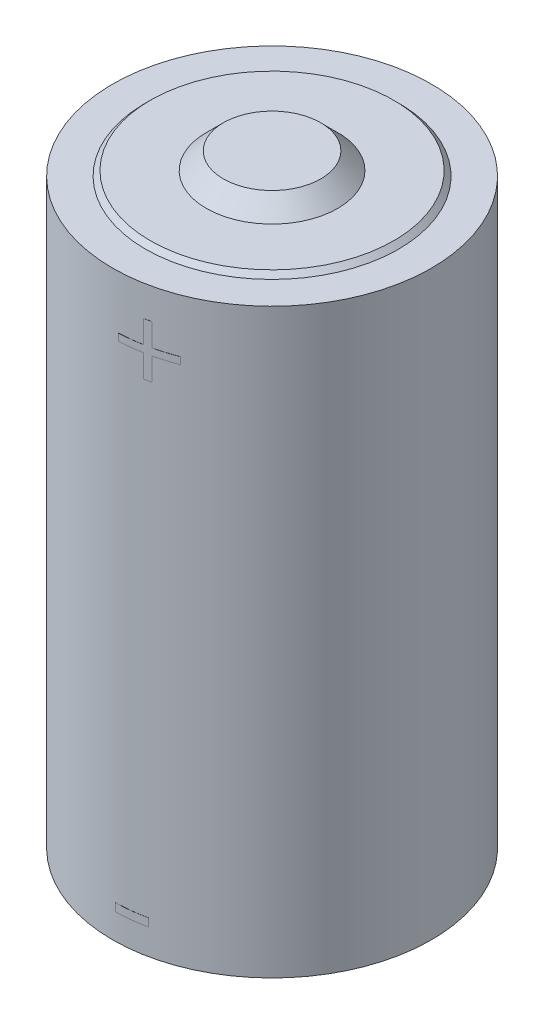
from build123d import *

# Parameters (mm, degrees)
SKETCH1_R           = 13.1
BOSS_EXTRUDE1_DEPTH = 47.8
SKETCH2_R           = 10
BOSS_EXTRUDE2_DEPTH = 0.4
SKETCH3_R           = 4
BOSS_EXTRUDE3_DEPTH = 1.4
CHAMFER2_SIZE       = 1.4
CHAMFER3_SIZE       = 0.4
SKETCH4_R           = 9
BOSS_EXTRUDE4_DEPTH = 0.4
CHAMFER4_SIZE       = 0.4
WRAP1_START         = 40.976923077
WRAP1_DEPTH         = 4.31474359
WRAP1_START_2       = 42.849358974
WRAP1_2_DEPTH       = 0.569871795
WRAP1_START_3       = 2.116666667
WRAP1_3_DEPTH       = 0.651282051


# Read off the part's stored shape, not the designer's step: Wrap1
with BuildPart() as part:
    # Sketch1 → Boss-Extrude1 (new body)
    with BuildSketch(Plane(origin=(0, 0, 0), x_dir=(1, 0, 0), z_dir=(0, 1, 0))):
        with Locations(Location((0, 0, 0), (0, 0, 90))):
            Circle(SKETCH1_R)
    extrude(amount=BOSS_EXTRUDE1_DEPTH)

    # Sketch2 → Boss-Extrude2 (add)
    with BuildSketch(Plane(origin=(0, 47.8, 0), x_dir=(1, 0, 0), z_dir=(0, 1, 0))):
        with Locations(Location((0, 0, 0), (0, 0, 270))):
            Circle(SKETCH2_R)
    extrude(amount=BOSS_EXTRUDE2_DEPTH)

    # Sketch3 → Boss-Extrude3 (add)
    with BuildSketch(Plane(origin=(0, 48.2, 0), x_dir=(1, 0, 0), z_dir=(0, 1, 0))):
        with Locations(Location((0, 0, 0), (0, 0, 270))):
            Circle(SKETCH3_R)
    extrude(amount=BOSS_EXTRUDE3_DEPTH)

    # Chamfer2
    chamfer2_edges = [part.edges().sort_by_distance(p)[0] for p in [
        (0, 48.2, -4),
    ]]
    chamfer(chamfer2_edges, length=CHAMFER2_SIZE - 0.0001)  # a hair under: the kernel refuses the full size

    # Chamfer3
    chamfer3_edges = [part.edges().sort_by_distance(p)[0] for p in [
        (0, 47.8, -10),
    ]]
    chamfer(chamfer3_edges, length=CHAMFER3_SIZE - 0.0001)  # a hair under: the kernel refuses the full size

    # Sketch4 → Boss-Extrude4 (add)
    with BuildSketch(Plane.XZ):
        with Locations(Location((0, 0, 0), (0, 0, 90))):
            Circle(SKETCH4_R)
    extrude(amount=BOSS_EXTRUDE4_DEPTH)

    # Chamfer4
    chamfer4_edges = [part.edges().sort_by_distance(p)[0] for p in [
        (0, 0, -9),
    ]]
    chamfer(chamfer4_edges, length=CHAMFER4_SIZE - 0.0001)  # a hair under: the kernel refuses the full size

    # Wrap1 outline → Wrap1 (add)
    with BuildSketch(Plane(origin=(0, 0, 0), x_dir=(1, 0, 0), z_dir=(0, 1, 0)).offset(WRAP1_START)):
        with BuildLine():
            Line((2.348137979, -12.887833333), (2.34993045, -12.897671375))
            ThreePointArc((2.34993045, -12.897671375), (2.62988756, -12.843511647), (2.908600522, -12.783275911))
            Line((2.908600522, -12.783275911), (2.906381909, -12.773525128))
            ThreePointArc((2.906381909, -12.773525128), (2.627881543, -12.833714918), (2.348137979, -12.887833333))
        make_face()
    extrude(amount=WRAP1_DEPTH)

    # Wrap1 2 outline → Wrap1 2 (add)
    with BuildSketch(Plane(origin=(0, 0, 0), x_dir=(1, 0, 0), z_dir=(0, 1, 0)).offset(WRAP1_START_2)):
        with BuildLine():
            ThreePointArc((0.488721144, -13.100887437), (1.422958155, -13.032547337), (2.34993045, -12.897671375))
            Line((2.34993045, -12.897671375), (2.348137979, -12.887833333))
            ThreePointArc((2.348137979, -12.887833333), (1.421872756, -13.022606416), (0.488348359, -13.090894388))
            Line((0.488348359, -13.090894388), (0.488721144, -13.100887437))
        make_face()
        with BuildLine():
            Line((2.906381909, -12.773525128), (2.908600522, -12.783275911))
            ThreePointArc((2.908600522, -12.783275911), (3.813980922, -12.542952186), (4.699889571, -12.238592158))
            Line((4.699889571, -12.238592158), (4.696304606, -12.229256848))
            ThreePointArc((4.696304606, -12.229256848), (3.811071706, -12.533384716), (2.906381909, -12.773525128))
        make_face()
    extrude(amount=WRAP1_2_DEPTH)

    # Wrap1 3 outline → Wrap1 3 (add)
    with BuildSketch(Plane(origin=(0, 0, 0), x_dir=(1, 0, 0), z_dir=(0, 1, 0)).offset(WRAP1_START_3)):
        with BuildLine():
            ThreePointArc((0.488721144, -13.100887437), (1.584826216, -13.01385515), (2.669782951, -12.835277909))
            Line((2.669782951, -12.835277909), (2.667746504, -12.82548746))
            ThreePointArc((2.667746504, -12.82548746), (1.462330473, -13.018125425), (0.244216621, -13.097723399))
            Line((0.244216621, -13.097723399), (0.244403046, -13.107721661))
            ThreePointArc((0.244403046, -13.107721661), (0.366578022, -13.104873923), (0.488721144, -13.100887437))
        make_face()
    extrude(amount=WRAP1_3_DEPTH)


solid = part.part
